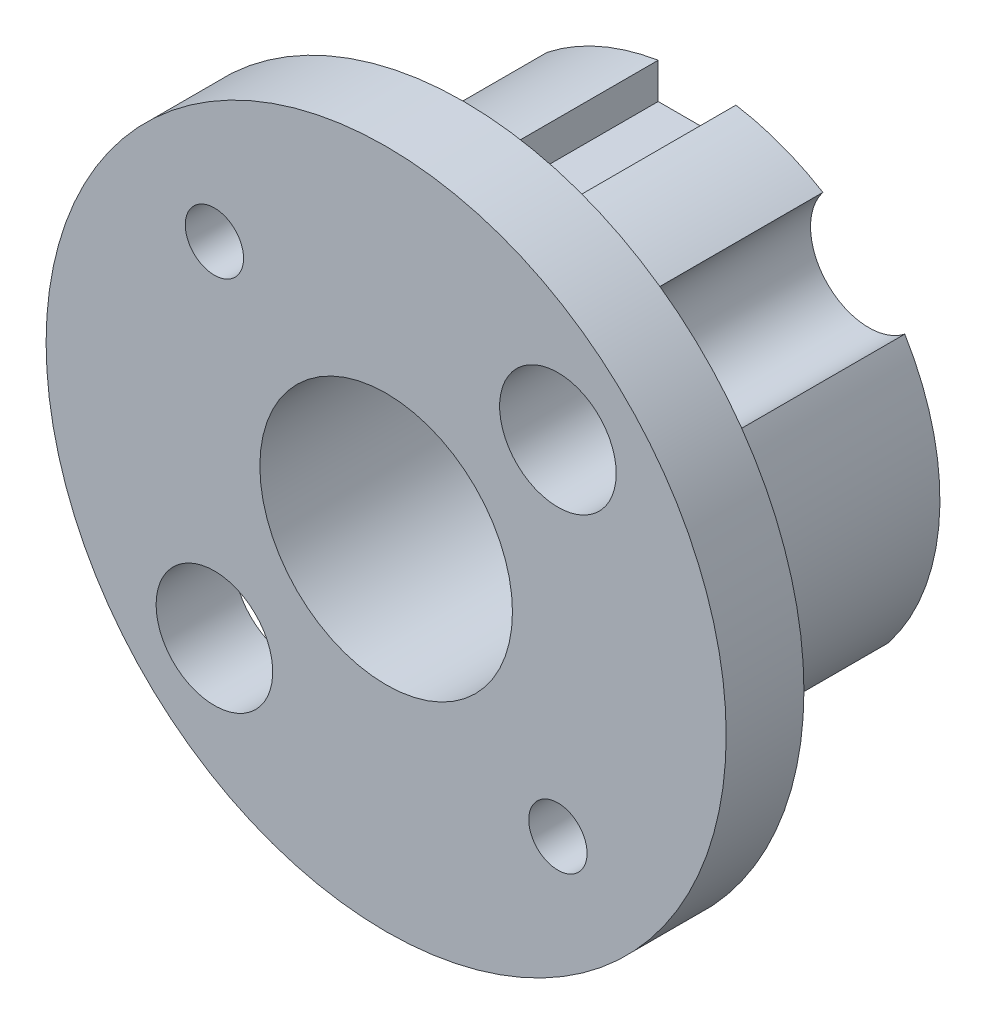
from build123d import *

# Parameters (mm, degrees)
SKETCH_1_R          = 12.5
EXTRUDE_1_DEPTH     = 12
SKETCH_2_W          = 4
SKETCH_2_H          = 3.769678913
SKETCH_2_H_2        = 4
CUT_EXTRUDE_1_DEPTH = 22.365860619
SKETCH_3_R          = 6.5
CUT_EXTRUDE_2_DEPTH = 22.272047386
SKETCH_5_R          = 17.5
EXTRUDE_1_2_DEPTH   = 4
SKETCH_4_R          = 3
SKETCH_4_R_2        = 1.5
SKETCH_4_R_3        = 6.5
CUT_EXTRUDE_3_DEPTH = 30.470324057
FILLET_2_R          = 2


with BuildPart() as part:
    # 草图1 → Extrude 1 (new body)
    with BuildSketch(Plane.XY):
        Circle(SKETCH_1_R)
    extrude(amount=EXTRUDE_1_DEPTH)

    # 草图2 → 切除-拉伸1 (cut, through all)
    with BuildSketch(Plane.XY.offset(12)):
        with Locations((0, -12.384839456)):
            Rectangle(SKETCH_2_W, SKETCH_2_H)
        with Locations((0, 12.5)):
            Rectangle(SKETCH_2_W, SKETCH_2_H_2)
    extrude(amount=-CUT_EXTRUDE_1_DEPTH, mode=Mode.SUBTRACT)

    # 草图3 → 切除-拉伸2 (cut, through all)
    with BuildSketch(Plane.XY.offset(12)):
        Circle(SKETCH_3_R)
    extrude(amount=-CUT_EXTRUDE_2_DEPTH, mode=Mode.SUBTRACT)

    # 草图5 → Extrude 1 2 (add)
    with BuildSketch(Plane(origin=(0, 0, 12), x_dir=(-1, 0, 0), z_dir=(0, 0, -1))):
        Circle(SKETCH_5_R)
    extrude(amount=-EXTRUDE_1_2_DEPTH)

    # 草图4 → 切除-拉伸3 (cut, through all)
    with BuildSketch(Plane.XY.offset(16)):
        with Locations((8.838834765, 8.838834765)):
            Circle(SKETCH_4_R)
        with Locations((-8.838834765, 8.838834765)):
            Circle(SKETCH_4_R_2)
        with Locations(Location((-8.838834765, -8.838834765, 0), (0, 0, 321.892102579))):
            Circle(SKETCH_4_R)
        with Locations(Location((8.838834765, -8.838834765, 0), (0, 0, 48.439812768))):
            Circle(SKETCH_4_R_2)
        Circle(SKETCH_4_R_3)
    extrude(amount=-CUT_EXTRUDE_3_DEPTH, mode=Mode.SUBTRACT)

    # 圆角2
    fillet_2_edges = [part.edges().sort_by_distance(p)[0] for p in [
        (-2, -11.41948134, 12),
        (2, -11.41948134, 12),
        (2, 11.41948134, 12),
        (-2, 11.41948134, 12),
    ]]
    fillet(fillet_2_edges, radius=FILLET_2_R - 0.0001)  # a hair under: the kernel refuses the full size


solid = part.part
